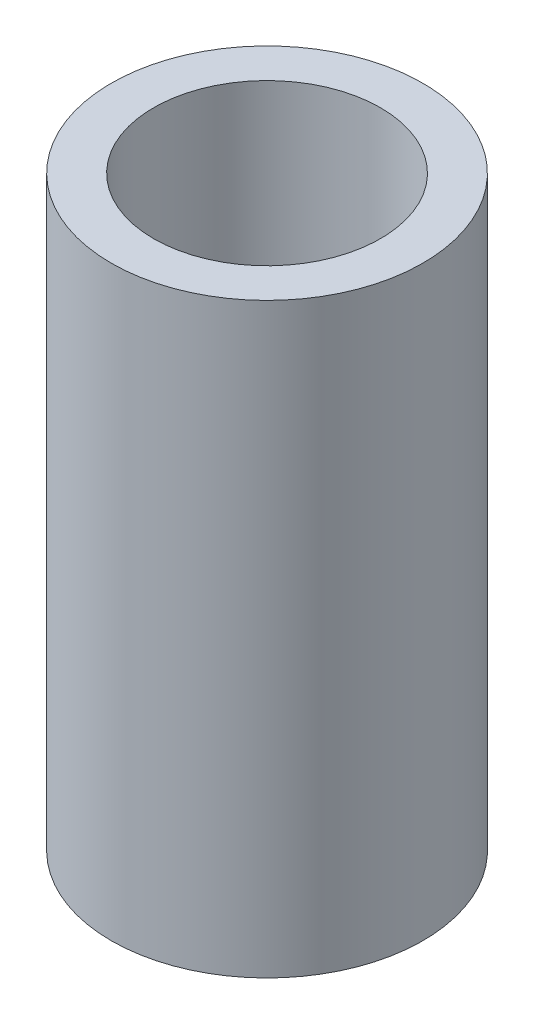
from build123d import *

# Parameters (mm, degrees)
SKETCH1_R           = 17.5
BOSS_EXTRUDE1_DEPTH = 65.893572688
SKETCH2_R           = 12.73985225
CUT_EXTRUDE1_DEPTH  = 71.387945855


with BuildPart() as part:
    # Sketch1 → Boss-Extrude1 (new body)
    with BuildSketch(Plane(origin=(0, 0, 0), x_dir=(1, 0, 0), z_dir=(0, 1, 0))):
        Circle(SKETCH1_R)
    extrude(amount=BOSS_EXTRUDE1_DEPTH)

    # Sketch2 → Cut-Extrude1 (cut, through all)
    with BuildSketch(Plane(origin=(0, 0, 0), x_dir=(1, 0, 0), z_dir=(0, 1, 0))):
        Circle(SKETCH2_R)
    extrude(amount=CUT_EXTRUDE1_DEPTH, mode=Mode.SUBTRACT)


solid = part.part
